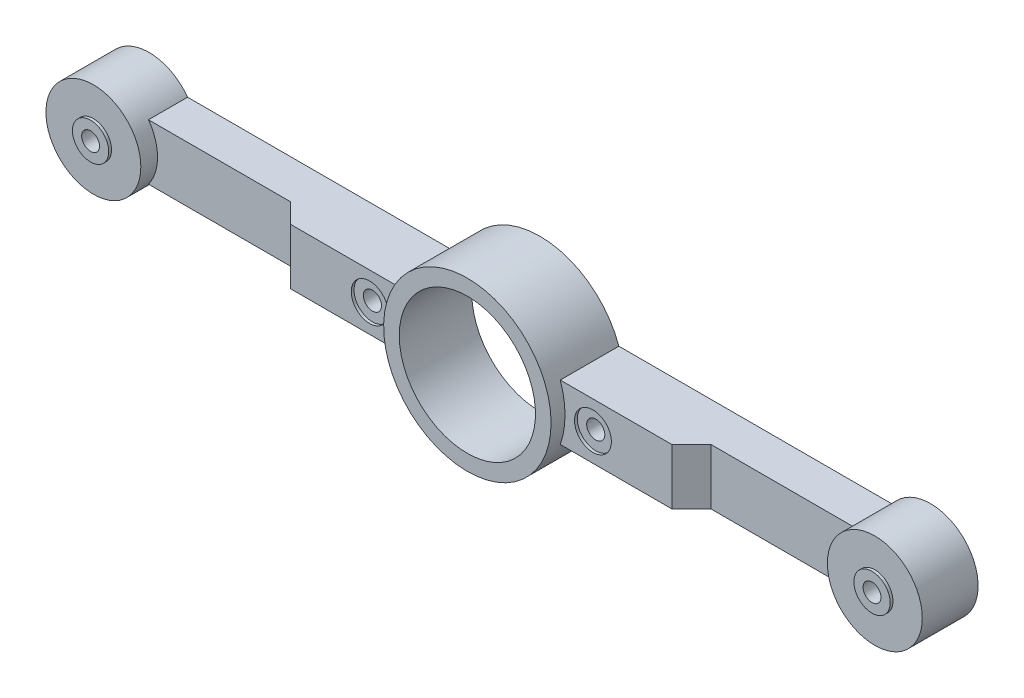
from build123d import *

# Parameters (mm, degrees)
SKETCH2_R               = 12
BOSS_EXTRUDE1_DEPTH     = 3
SKETCH3_R               = 15
SKETCH3_R_2             = 12
BOSS_EXTRUDE2_DEPTH     = 9
BOSS_EXTRUDE5_START     = 3
SKETCH6_R               = 8.5
BOSS_EXTRUDE5_DEPTH     = 3
BOSS_EXTRUDE6_START     = 3
SKETCH8_W               = 20
SKETCH8_H               = 10
BOSS_EXTRUDE6_DEPTH     = 3.5
CHAMFER2_SIZE           = 3.5
BOSS_EXTRUDE8_START     = -4
SKETCH14_R              = 12
BOSS_EXTRUDE8_DEPTH     = 4
CUT_EXTRUDE1_DEPTH      = 81.425431301
CUT_EXTRUDE1_DEPTH_BACK = 81.425431301
SKETCH7_R               = 1.625
CUT_EXTRUDE2_DEPTH      = 81.425431301
CUT_EXTRUDE2_DEPTH_BACK = 81.425431301
SKETCH4_R               = 1.6
CUT_EXTRUDE3_START      = 6.5
SKETCH9_R               = 3.3
CUT_EXTRUDE3_DEPTH      = 0.5
CUT_EXTRUDE4_START      = -4
SKETCH10_R              = 3.3
CUT_EXTRUDE4_DEPTH      = 1
CUT_EXTRUDE5_DEPTH      = 85.425431301
CUT_EXTRUDE5_DEPTH_BACK = 81.425431301
CUT_EXTRUDE5_START      = -4
SKETCH11_R              = 12.2
BOSS_EXTRUDE7_START     = 6
SKETCH12_R              = 3.25
SKETCH12_R_2            = 1.6
BOSS_EXTRUDE7_DEPTH     = 0.5
CUT_EXTRUDE6_START      = -1
SKETCH15_R              = 3.3
CUT_EXTRUDE6_DEPTH      = 3


with BuildPart() as part:
    # Sketch2 → Boss-Extrude1 (new body)
    with BuildSketch(Plane.XY):
        with BuildLine():
            Line((14.142135624, 5), (63.126136458, 5))
            ThreePointArc((63.126136458, 5), (78.5, 0), (63.126136458, -5))
            Line((63.126136458, -5), (14.142135624, -5))
            ThreePointArc((14.142135624, -5), (0, -15), (-14.142135624, -5))
            Line((-14.142135624, -5), (-63.126136458, -5))
            ThreePointArc((-63.126136458, -5), (-78.5, 0), (-63.126136458, 5))
            Line((-63.126136458, 5), (-14.142135624, 5))
            ThreePointArc((-14.142135624, 5), (0, 15), (14.142135624, 5))
        make_face()
        Circle(SKETCH2_R, mode=Mode.SUBTRACT)
    extrude(amount=BOSS_EXTRUDE1_DEPTH)

    # Sketch3 → Boss-Extrude2 (add)
    with BuildSketch(Plane.XY):
        with Locations(Location((0, 0, 0), (0, 0, 199.471220634))):
            Circle(SKETCH3_R)
        Circle(SKETCH3_R_2, mode=Mode.SUBTRACT)
    extrude(amount=BOSS_EXTRUDE2_DEPTH)

    # Sketch6 → Boss-Extrude5 (add)
    with BuildSketch(Plane.XY.offset(BOSS_EXTRUDE5_START)):
        with Locations(Location((-70, 0, 0), (0, 0, 36.031879072))):
            Circle(SKETCH6_R)
        with Locations(Location((70, 0, 0), (0, 0, 216.031879072))):
            Circle(SKETCH6_R)
    extrude(amount=BOSS_EXTRUDE5_DEPTH)

    # Sketch8 → Boss-Extrude6 (add)
    with BuildSketch(Plane.XY.offset(BOSS_EXTRUDE6_START)):
        with Locations((-24.142135624, 0)):
            Rectangle(SKETCH8_W, SKETCH8_H)
        with Locations((24.142135624, 0)):
            Rectangle(SKETCH8_W, SKETCH8_H)
    extrude(amount=BOSS_EXTRUDE6_DEPTH)

    # Chamfer2
    chamfer2_edges = [part.edges().sort_by_distance(p)[0] for p in [
        (-34.142135624, 0, 3),
        (34.142135624, 0, 3),
    ]]
    chamfer(chamfer2_edges, length=CHAMFER2_SIZE - 0.0001)  # a hair under: the kernel refuses the full size

    # Sketch14 → Boss-Extrude8 (add)
    with BuildSketch(Plane.XY.offset(BOSS_EXTRUDE8_START)):
        with BuildLine():
            Line((14.142135624, 5), (63.126136458, 5))
            ThreePointArc((63.126136458, 5), (78.5, 0), (63.126136458, -5))
            Line((63.126136458, -5), (14.142135624, -5))
            ThreePointArc((14.142135624, -5), (0, -15), (-14.142135624, -5))
            Line((-14.142135624, -5), (-63.126136458, -5))
            ThreePointArc((-63.126136458, -5), (-78.5, 0), (-63.126136458, 5))
            Line((-63.126136458, 5), (-14.142135624, 5))
            ThreePointArc((-14.142135624, 5), (0, 15), (14.142135624, 5))
        make_face()
        Circle(SKETCH14_R, mode=Mode.SUBTRACT)
    extrude(amount=BOSS_EXTRUDE8_DEPTH)

    # Sketch7 → Cut-Extrude1 (cut, two sides: drawn at the far end of the back side and taken through both)
    with BuildSketch(Plane.XY.offset(-CUT_EXTRUDE1_DEPTH_BACK)):
        with Locations(Location((-20, 0, 0), (0, 0, 180))):
            Circle(SKETCH7_R)
        with Locations(Location((20, 0, 0), (0, 0, 180))):
            Circle(SKETCH7_R)
    extrude(amount=CUT_EXTRUDE1_DEPTH + CUT_EXTRUDE1_DEPTH_BACK, mode=Mode.SUBTRACT)

    # Sketch4 → Cut-Extrude2 (cut, two sides: drawn at the far end of the back side and taken through both)
    with BuildSketch(Plane.XY.offset(-CUT_EXTRUDE2_DEPTH_BACK)):
        with Locations((-70, 0)):
            Circle(SKETCH4_R)
        with Locations((70, 0)):
            Circle(SKETCH4_R)
    extrude(amount=CUT_EXTRUDE2_DEPTH + CUT_EXTRUDE2_DEPTH_BACK, mode=Mode.SUBTRACT)

    # Sketch9 → Cut-Extrude3 (cut)
    with BuildSketch(Plane.XY.offset(CUT_EXTRUDE3_START)):
        with Locations(Location((-20, 0, 0), (0, 0, 180))):
            Circle(SKETCH9_R)
        with Locations(Location((20, 0, 0), (0, 0, 180))):
            Circle(SKETCH9_R)
    extrude(amount=-CUT_EXTRUDE3_DEPTH, mode=Mode.SUBTRACT)

    # Sketch10 → Cut-Extrude4 (cut)
    with BuildSketch(Plane.XY.offset(CUT_EXTRUDE4_START)):
        with Locations((-70, 0)):
            Circle(SKETCH10_R)
        with Locations((70, 0)):
            Circle(SKETCH10_R)
    extrude(amount=CUT_EXTRUDE4_DEPTH, mode=Mode.SUBTRACT)

    # Sketch11 → Cut-Extrude5 (cut, two sides: drawn at the far end of the back side and taken through both)
    with BuildSketch(Plane.XY.offset(CUT_EXTRUDE5_START - CUT_EXTRUDE5_DEPTH_BACK)):
        with Locations(Location((0, 0, 0), (0, 0, 180))):
            Circle(SKETCH11_R)
    extrude(amount=CUT_EXTRUDE5_DEPTH + CUT_EXTRUDE5_DEPTH_BACK, mode=Mode.SUBTRACT)

    # Sketch12 → Boss-Extrude7 (add)
    # profile 1 of 2: a face of its own
    with BuildSketch(Plane.XY.offset(BOSS_EXTRUDE7_START)):
        with Locations((-70, 0)):
            Circle(SKETCH12_R)
        with Locations((-70, 0)):
            Circle(SKETCH12_R_2, mode=Mode.SUBTRACT)
    # profile 2 of 2: a face of its own
    with BuildSketch(Plane.XY.offset(BOSS_EXTRUDE7_START)):
        with Locations((70, 0)):
            Circle(SKETCH12_R)
        with Locations((70, 0)):
            Circle(SKETCH12_R_2, mode=Mode.SUBTRACT)
    extrude(amount=BOSS_EXTRUDE7_DEPTH)

    # Sketch15 → Cut-Extrude6 (cut)
    with BuildSketch(Plane.XY.offset(CUT_EXTRUDE6_START)):
        with Locations(Location((-20, 0, 0), (0, 0, 180))):
            Circle(SKETCH15_R)
        with Locations(Location((20, 0, 0), (0, 0, 180))):
            Circle(SKETCH15_R)
    extrude(amount=-CUT_EXTRUDE6_DEPTH, mode=Mode.SUBTRACT)


solid = part.part
